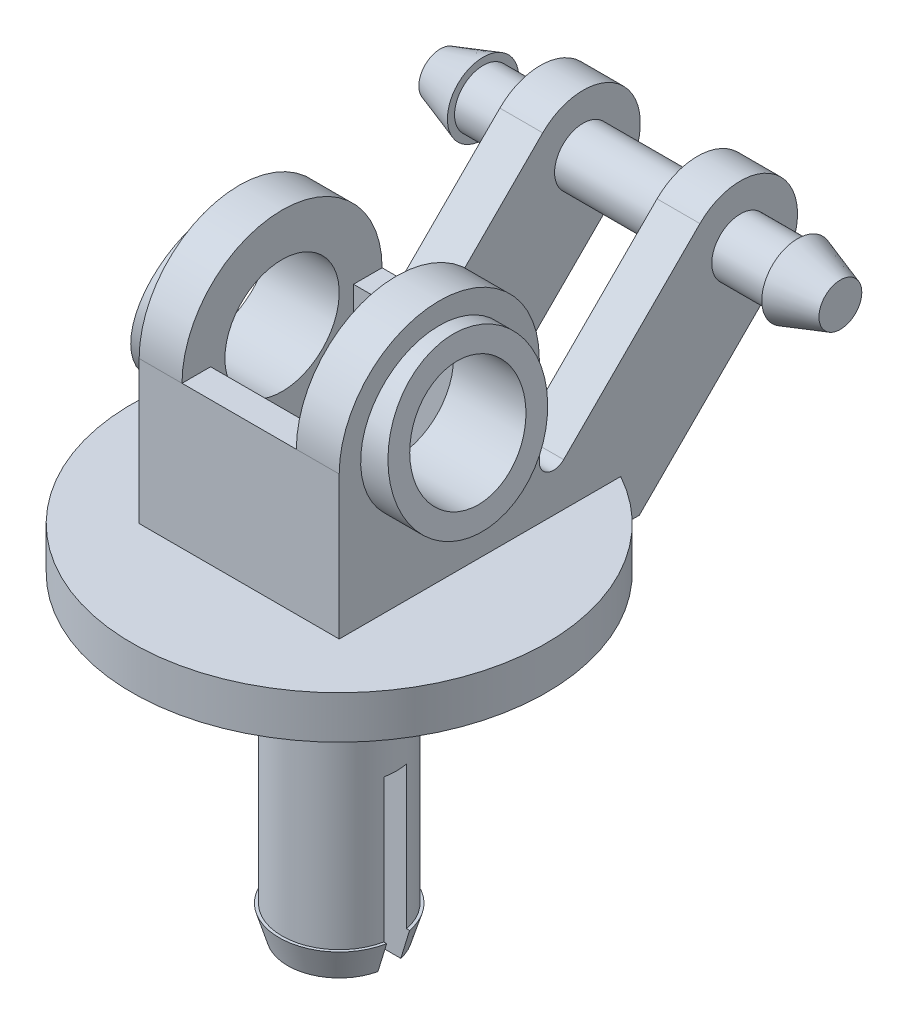
from build123d import *

# Parameters (mm, degrees)
SKETCH_1_R          = 7.25
EXTRUDE_1_DEPTH     = 1.5
EXTRUDE_2_DEPTH     = 1.5
FILLET_1_R          = 0.5
CUT_EXTRUDE_1_REACH = 21.305
SKETCH_3_R          = 2
EXTRUDE_START       = 1.5
SKETCH_4_R          = 2.75
SKETCH_4_R_2        = 2
EXTRUDE_3_DEPTH     = 1.5
CUT_EXTRUDE_2_REACH = 22.241
SKETCH_6_R          = 1
EXTRUDE_4_DEPTH     = 2
SKETCH_7_R          = 1.25
SKETCH_8_R          = 0.75
EXTRUDE_START_2     = 2
SKETCH_9_R          = 1
SKETCH_9_W          = 1
SKETCH_9_H          = 5
EXTRUDE_5_DEPTH     = 2
SKETCH_10_R         = 3
EXTRUDE_6_DEPTH     = 1
SKETCH_11_R         = 2
EXTRUDE_7_DEPTH     = 9
SKETCH_12_R         = 2.1
SKETCH_13_R         = 1.8
SKETCH_14_W         = 8
SKETCH_14_H         = 0.8
CUT_EXTRUDE_3_DEPTH = 6


# Read off the part's stored shape, not the designer's step: 镜向1
with BuildPart() as part:
    # 草图1 → 凸台-拉伸1 (new body)
    with BuildSketch(Plane(origin=(0, 0, 0), x_dir=(1, 0, 0), z_dir=(0, 1, 0))):
        with Locations(Location((0, 0, 0), (0, 0, 270))):
            Circle(SKETCH_1_R)
    extrude(amount=EXTRUDE_1_DEPTH)

    # 草图2 → 凸台-拉伸2 (add)
    with BuildSketch(Plane(origin=(3.5, 0, 0), x_dir=(0, 0, -1), z_dir=(1, 0, 0))):
        with BuildLine():
            Line((0, 0), (-3.5, 0))
            Line((-3.5, 0), (-3.5, 6.5))
            ThreePointArc((-3.5, 6.5), (0, 10), (3.5, 6.5))
            Line((3.5, 6.5), (3.5, 2.156854249))
            Line((3.5, 2.156854249), (9.121320344, 7.778174593))
            ThreePointArc((9.121320344, 7.778174593), (11.949747468, 7.778174593), (11.949747468, 4.949747468))
            Line((11.949747468, 4.949747468), (7, 0))
            Line((7, 0), (0, 0))
        make_face()
    extrude(amount=-EXTRUDE_2_DEPTH)

    # 圆角1
    fillet_1_edges = [part.edges().sort_by_distance(p)[0] for p in [
        (2.75, 2.156854249, -3.5),
    ]]
    fillet(fillet_1_edges, radius=FILLET_1_R)

    # 草图3 → 切除-拉伸1 (cut, up to next)
    with BuildSketch(Plane(origin=(3.5, 0, 0), x_dir=(0, 0, -1), z_dir=(1, 0, 0)), mode=Mode.PRIVATE) as cut_extrude_1_sk1:
        with Locations((0, 6.5)):
            Circle(SKETCH_3_R)
    cut_extrude_1_tool1 = extrude(cut_extrude_1_sk1.sketch, amount=-CUT_EXTRUDE_1_REACH, mode=Mode.PRIVATE) & part.part
    add(cut_extrude_1_tool1.solids().sort_by_distance((3.5, 6.5, 0))[0], mode=Mode.SUBTRACT)

    # 草图4 → 凸台-拉伸3 (add)
    with BuildSketch(Plane(origin=(3.5, 0, 0), x_dir=(0, 0, -1), z_dir=(1, 0, 0)).offset(EXTRUDE_START)):
        with Locations((0, 6.5)):
            Circle(SKETCH_4_R)
        with Locations((0, 6.5)):
            Circle(SKETCH_4_R_2, mode=Mode.SUBTRACT)
    extrude(amount=-EXTRUDE_3_DEPTH)

    # 草图5 → 切除-拉伸2 (cut, up to next)
    with BuildSketch(Plane.XY.offset(3.5), mode=Mode.PRIVATE) as cut_extrude_2_sk1:
        Polygon((5, 9.25), (4, 9.25), (5, 3.75), align=None)
    cut_extrude_2_tool1 = extrude(cut_extrude_2_sk1.sketch, amount=-CUT_EXTRUDE_2_REACH, mode=Mode.PRIVATE) & part.part
    add(cut_extrude_2_tool1.solids().sort_by_distance((4.666667, 7.416667, 3.5))[0], mode=Mode.SUBTRACT)

    # 草图6 → 凸台-拉伸4 (add)
    with BuildSketch(Plane(origin=(3.5, 0, 0), x_dir=(0, 0, -1), z_dir=(1, 0, 0))):
        with Locations((10.535533906, 6.363961031)):
            Circle(SKETCH_6_R)
    extrude(amount=EXTRUDE_4_DEPTH)

    # 草图7 → 放样1 section 0
    with BuildSketch(Plane(origin=(5.5, 0, 0), x_dir=(0, 0, -1), z_dir=(1, 0, 0))):
        with Locations((10.535533906, 6.363961031)):
            Circle(SKETCH_7_R)
    # 草图8 → 放样1 section 1
    with BuildSketch(Plane(origin=(7, 0, 0), x_dir=(0, 0, -1), z_dir=(1, 0, 0))):
        with Locations((10.535533906, 6.363961031)):
            Circle(SKETCH_8_R)
    loft()

    # 草图9 → 凸台-拉伸5 (add)
    with BuildSketch(Plane.ZY.offset(-2).offset(EXTRUDE_START_2)):
        with Locations(Location((-10.535533906, 6.363961031, 0), (0, 0, 180))):
            Circle(SKETCH_9_R)
        with Locations((3, 4)):
            Rectangle(SKETCH_9_W, SKETCH_9_H)
        with Locations((-3, 4)):
            Rectangle(SKETCH_9_W, SKETCH_9_H)
    extrude(amount=-EXTRUDE_5_DEPTH)

    # 镜向1: part across plane


with BuildPart() as part_1:
    add(part.part)
    add(part.part.mirror(Plane(origin=(0, 0, 0), x_dir=(0, 0, 1), z_dir=(1, 0, 0))))

    # 草图10 → 凸台-拉伸6 (add)
    with BuildSketch(Plane.XZ):
        with Locations(Location((0, 0, 0), (0, 0, 90))):
            Circle(SKETCH_10_R)
    extrude(amount=EXTRUDE_6_DEPTH)

    # 草图11 → 凸台-拉伸7 (add)
    with BuildSketch(Plane.XZ.offset(1)):
        with Locations(Location((0, 0, 0), (0, 0, 270))):
            Circle(SKETCH_11_R)
    extrude(amount=EXTRUDE_7_DEPTH)

    # 草图12 → 放样2 section 0
    with BuildSketch(Plane.XZ.offset(10)):
        Circle(SKETCH_12_R)
    # 草图13 → 放样2 section 1
    with BuildSketch(Plane(origin=(0, -11, 0), x_dir=(-1, 0, 0), z_dir=(0, -1, 0))):
        Circle(SKETCH_13_R)
    loft()

    # 草图14 → 切除-拉伸3 (cut)
    with BuildSketch(Plane.XZ.offset(11)):
        Rectangle(SKETCH_14_W, SKETCH_14_H)
    extrude(amount=-CUT_EXTRUDE_3_DEPTH, mode=Mode.SUBTRACT)


solid = part_1.part
